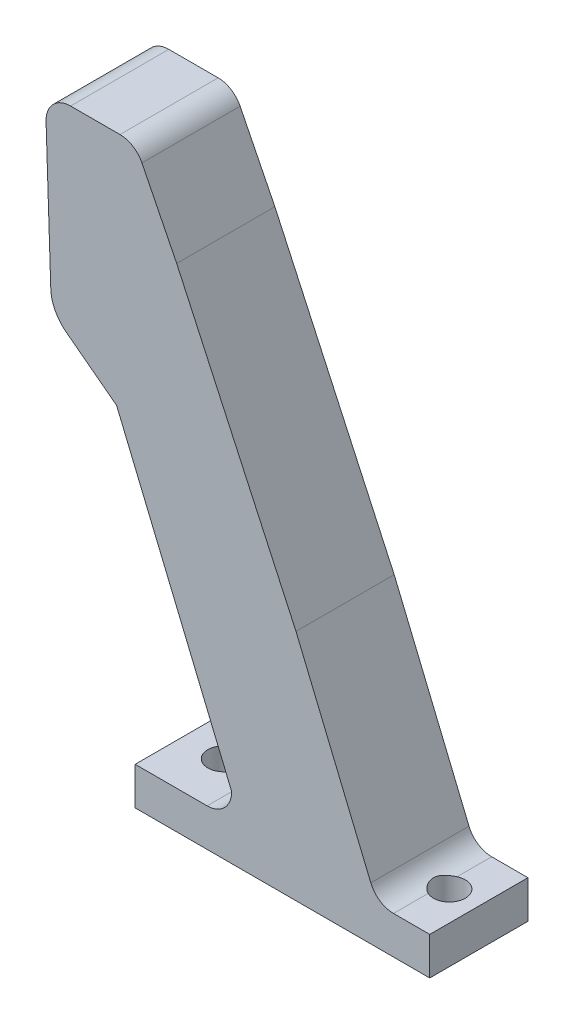
from build123d import *

# Parameters (mm, degrees)
BOSS_EXTRUDE1_DEPTH     = 20
CUT_EXTRUDE1_DEPTH      = 20
CUT_EXTRUDE1_DEPTH_BACK = 20
SKETCH3_R               = 3.25


with BuildPart() as part:
    # Sketch1 → Boss-Extrude1 (new body)
    with BuildSketch(Plane.XY):
        with BuildLine():
            Line((-44.097792079, -29.156477567), (-44.097792079, -36.850100287))
            Line((-44.097792079, -36.850100287), (15.902191644, -36.850100287))
            Line((15.902191644, -36.850100287), (15.902191644, -29.156477567))
            Line((15.902191644, -29.156477567), (8.516601235, -29.156477567))
            ThreePointArc((8.516601235, -29.156477567), (5.739613958, -28.31440273), (3.897999124, -26.071814232))
            Line((3.897999124, -26.071814232), (-11.340504171, 10.673988619))
            Line((-11.340504171, 10.673988619), (-35.64147303, 63.423134111))
            Line((-35.64147303, 63.423134111), (-42.717161807, 77.613253206))
            ThreePointArc((-42.717161807, 77.613253206), (-44.560759506, 79.633890402), (-47.19173837, 80.382073118))
            Line((-47.19173837, 80.382073118), (-57.247452636, 80.382073118))
            ThreePointArc((-57.247452636, 80.382073118), (-60.840851903, 78.8587787), (-62.244729152, 75.217065799))
            Line((-62.244729152, 75.217065799), (-61.293211228, 46.400173199))
            ThreePointArc((-61.293211228, 46.400173199), (-60.463803823, 42.862224873), (-58.148414135, 40.061516822))
            Line((-58.148414135, 40.061516822), (-47.87808719, 32.258784099))
            Line((-47.87808719, 32.258784099), (-24.43830161, -24.156477567))
            ThreePointArc((-24.43830161, -24.156477567), (-25.902767704, -27.692011473), (-29.43830161, -29.156477567))
            Line((-29.43830161, -29.156477567), (-35.915534593, -29.156477567))
            Line((-35.915534593, -29.156477567), (-44.097792079, -29.156477567))
        make_face()
    extrude(amount=BOSS_EXTRUDE1_DEPTH)

    # Sketch3 → Cut-Extrude1 (cut, two sides: drawn at the far end of the back side and taken through both)
    with BuildSketch(Plane(origin=(0, -29.156477567, 0), x_dir=(1, 0, 0), z_dir=(0, 1, 0)).offset(-CUT_EXTRUDE1_DEPTH_BACK)):
        with Locations((9.902191644, -10)):
            Circle(SKETCH3_R)
        with Locations((-36.038433316, -10)):
            Circle(SKETCH3_R)
    extrude(amount=CUT_EXTRUDE1_DEPTH + CUT_EXTRUDE1_DEPTH_BACK, mode=Mode.SUBTRACT)


solid = part.part
